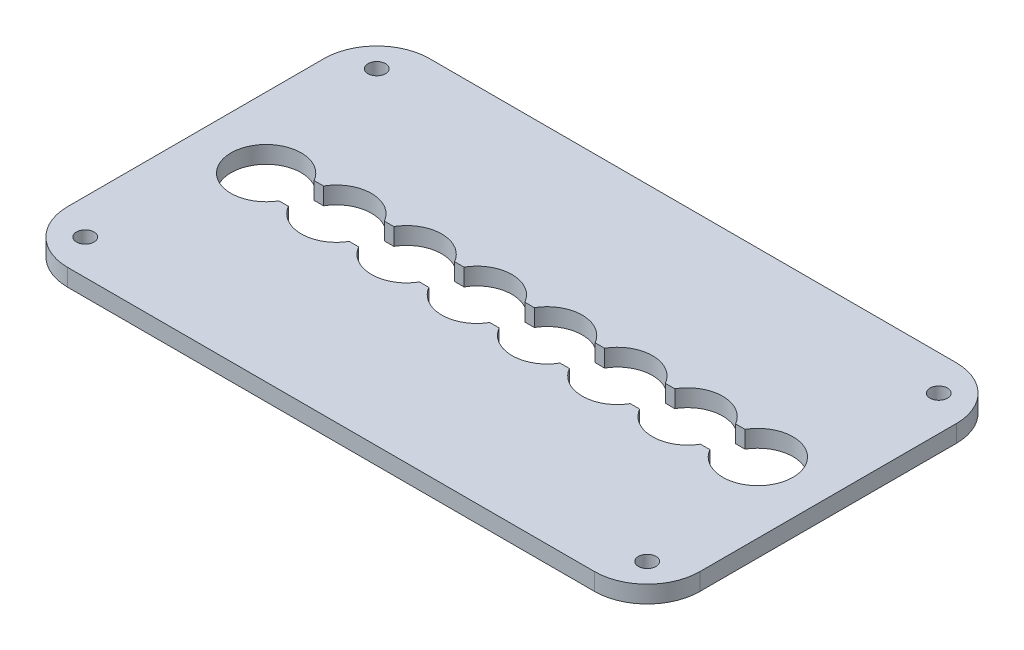
from build123d import *
from build123d.topology import SkipClean

# Parameters (mm, degrees)
SALIENTE_EXTRUIR1_DEPTH     = 103
CROQUIS2_W                  = 5
CROQUIS2_H                  = 50
CROQUIS2_H_2                = 80
SALIENTE_EXTRUIR2_DEPTH     = 35
REDONDEO1_R                 = 5
REDONDEO2_R                 = 5
SALIENTE_EXTRUIR3_DEPTH     = 322
REDONDEO4_R                 = 10
REDONDEO5_R                 = 10
CORTAR_EXTRUIR1_DEPTH       = 384.597445247
CORTAR_EXTRUIR1_DEPTH_BACK  = 384.597445247
CROQUIS4_W                  = 120
CROQUIS4_H                  = 165.437368142
CROQUIS8_W                  = 103
CROQUIS8_H                  = 7
SALIENTE_EXTRUIR5_DEPTH     = 200
REDONDEO6_R                 = 15
CROQUIS10_R                 = 2.5
CORTAR_EXTRUIR5_DEPTH       = 289.46836915
CORTAR_EXTRUIR6_DEPTH       = 10
SALIENTE_EXTRUIR6_DEPTH     = 12
CROQUIS12_W                 = 103
CROQUIS12_H                 = 5
SALIENTE_EXTRUIR7_DEPTH     = 41
REDONDEO7_R                 = 10
CORTAR_EXTRUIR7_DEPTH       = 384.597445247
CORTAR_EXTRUIR7_DEPTH_BACK  = 384.597445247
CROQUIS13_W                 = 211.982826688
CROQUIS13_H                 = 7
REDONDEO8_R                 = 5
CORTAR_EXTRUIR9_DEPTH       = 386.127251697
CORTAR_EXTRUIR9_DEPTH_BACK  = 386.127251697
CROQUIS14_W                 = 102.672801221
CROQUIS14_H                 = 112.094986942
REDONDEO9_R                 = 15
CORTAR_EXTRUIR10_DEPTH      = 295.63536787
CORTAR_EXTRUIR10_DEPTH_BACK = 295.63536787
CROQUIS15_R                 = 2.5
CORTAR_EXTRUIR11_DEPTH      = 0.1


# Some blends are built 0.0001 mm under size
with BuildPart() as part:
    # Croquis1 → Saliente-Extruir1 (new body)
    with BuildSketch(Plane.XY):
        with BuildLine():
            Line((0, 0), (0, -5))
            ThreePointArc((0, -5), (4.393398282, -15.606601718), (15, -20))
            Line((15, -20), (337, -20))
            ThreePointArc((337, -20), (347.606601718, -15.606601718), (352, -5))
            Line((352, -5), (352, 0))
            Line((352, 0), (367, 0))
            Line((367, 0), (367, -5))
            ThreePointArc((367, -5), (358.213203436, -26.213203436), (337, -35))
            Line((337, -35), (15, -35))
            ThreePointArc((15, -35), (-6.213203436, -26.213203436), (-15, -5))
            Line((-15, -5), (-15, 0))
            Line((-15, 0), (0, 0))
        make_face()
    extrude(amount=SALIENTE_EXTRUIR1_DEPTH)

    # Croquis2 → Saliente-Extruir2 (add)
    with BuildSketch(Plane(origin=(0, 0, 0), x_dir=(1, 0, 0), z_dir=(0, 1, 0))):
        with Locations((-7.5, -50.145888002)):
            Rectangle(CROQUIS2_W, CROQUIS2_H)
        with Locations((359.5, -51.5)):
            Rectangle(CROQUIS2_W, CROQUIS2_H_2)
    extrude(amount=SALIENTE_EXTRUIR2_DEPTH)

    # Redondeo1
    redondeo1_edges = [part.edges().sort_by_distance(p)[0] for p in [
        (-10, 0, 50.145888002),
        (-7.5, 0, 75.145888002),
        (-5, 0, 50.145888002),
        (-7.5, 0, 25.145888002),
        (357, 0, 51.5),
        (359.5, 0, 91.5),
        (362, 0, 51.5),
        (359.5, 0, 11.5),
    ]]
    fillet(redondeo1_edges, radius=REDONDEO1_R - 0.0001)  # a hair under: the kernel refuses the full size

    # Redondeo2
    redondeo2_edges = [part.edges().sort_by_distance(p)[0] for p in [
        (-7.5, 35, 75.145888002),
        (-7.5, 35, 25.145888002),
        (359.5, 35, 91.5),
        (359.5, 35, 11.5),
    ]]
    fillet(redondeo2_edges, radius=REDONDEO2_R)

    # Croquis3 → Saliente-Extruir3 (add)
    with BuildSketch(Plane(origin=(15, 0, 0), x_dir=(0, 0, -1), z_dir=(1, 0, 0))):
        Polygon((-76.5, -35), (-70.5, -35), (-70.5, -37), (-32.5, -37), (-32.5, -35), (-26.5, -35), (-26.5, -43), (-76.5, -43), align=None)
    extrude(amount=SALIENTE_EXTRUIR3_DEPTH)

    # Redondeo4
    # the kernel refuses this fillet: 10 mm, written as the material it adds along each edge
    with BuildSketch(Plane(origin=(15, -35, 76.5), x_dir=(0, 0, 1), z_dir=(1, 0, 0))) as redondeo4_piece_1:
        with BuildLine():
            CenterArc((9.797958971, 10), REDONDEO4_R, 191.536959033, 78.463040967)
            Line((0, 8), (-0.195959179, 7.96))
            ThreePointArc((-0.195959179, 7.96), (-0.2, 4), (-0.2, 0))
            Line((-0.2, 0), (0, -0.2))
            Line((0, -0.2), (9.797958971, -0.2))
            Line((9.797958971, -0.2), (9.797958971, 0))
        make_face()
    extrude(amount=322)
    with BuildSketch(Plane(origin=(15, -35, 26.5), x_dir=(0, 0, -1), z_dir=(1, 0, 0))) as redondeo4_piece_2:
        with BuildLine():
            CenterArc((9.797958971, -10), REDONDEO4_R, 90, 78.463040967)
            Line((0, -8), (-0.195959179, -7.96))
            ThreePointArc((-0.195959179, -7.96), (-0.2, -4), (-0.2, 0))
            Line((-0.2, 0), (0, 0.2))
            Line((0, 0.2), (9.797958971, 0.2))
            Line((9.797958971, 0.2), (9.797958971, 0))
        make_face()
    extrude(amount=322)

    # Redondeo5
    redondeo5_edges = [part.edges().sort_by_distance(p)[0] for p in [
        (176, -43, 76.5),
        (176, -43, 26.5),
    ]]
    fillet(redondeo5_edges, radius=REDONDEO5_R)

    # Croquis4 → Cortar-Extruir1 (cut, two sides: drawn at the far end of the back side and taken through both)
    with BuildSketch(Plane.XY.offset(103).offset(-CORTAR_EXTRUIR1_DEPTH_BACK)):
        with Locations((236, 7.126913707)):
            Rectangle(CROQUIS4_W, CROQUIS4_H)
    extrude(amount=CORTAR_EXTRUIR1_DEPTH + CORTAR_EXTRUIR1_DEPTH_BACK, mode=Mode.SUBTRACT)


with BuildPart() as body_2:
    # of the pieces the cut leaves, the one that is kept (cortar_extruir1_keep)
    add(part.part.solids().sort_by_distance((296, -39, 24.702041029))[0])

    # Croquis8 → Saliente-Extruir5 (add)
    with BuildSketch(Plane.ZY.offset(-296)):
        with Locations((51.5, -23.5)):
            Rectangle(CROQUIS8_W, CROQUIS8_H)
    extrude(amount=SALIENTE_EXTRUIR5_DEPTH)

    # Redondeo6
    redondeo6_edges = [body_2.edges().sort_by_distance(p)[0] for p in [
        (96, -23.5, 103),
        (96, -23.5, 0),
    ]]
    fillet(redondeo6_edges, radius=REDONDEO6_R)

    # Croquis10 → Cortar-Extruir5 (cut, through all)
    with BuildSketch(Plane(origin=(362, 0, 0), x_dir=(0, 0, -1), z_dir=(1, 0, 0))):
        with Locations(Location((-80.5, 20, 0), (0, 0, 90))):
            Circle(CROQUIS10_R)
        with Locations(Location((-22.5, 20, 0), (0, 0, 90))):
            Circle(CROQUIS10_R)
    extrude(amount=-CORTAR_EXTRUIR5_DEPTH, mode=Mode.SUBTRACT)

    # Croquis9 → Cortar-Extruir6 (cut)
    with BuildSketch(Plane.XZ.offset(27)):
        with BuildLine():
            Line((144.660254038, 56.5), (147.339745962, 56.5))
            ThreePointArc((147.339745962, 56.5), (156, 61.5), (164.660254038, 56.5))
            Line((164.660254038, 56.5), (167.339745962, 56.5))
            ThreePointArc((167.339745962, 56.5), (176, 61.5), (184.660254038, 56.5))
            Line((184.660254038, 56.5), (187.339745962, 56.5))
            ThreePointArc((187.339745962, 56.5), (196, 61.5), (204.660254038, 56.5))
            Line((204.660254038, 56.5), (207.339745962, 56.5))
            ThreePointArc((207.339745962, 56.5), (216, 61.5), (224.660254038, 56.5))
            Line((224.660254038, 56.5), (227.339745962, 56.5))
            ThreePointArc((227.339745962, 56.5), (236, 61.5), (244.660254038, 56.5))
            Line((244.660254038, 56.5), (247.339745962, 56.5))
            ThreePointArc((247.339745962, 56.5), (266, 51.5), (247.339745962, 46.5))
            Line((247.339745962, 46.5), (244.660254038, 46.5))
            ThreePointArc((244.660254038, 46.5), (236, 41.5), (227.339745962, 46.5))
            Line((227.339745962, 46.5), (224.660254038, 46.5))
            ThreePointArc((224.660254038, 46.5), (216, 41.5), (207.339745962, 46.5))
            Line((207.339745962, 46.5), (204.660254038, 46.5))
            ThreePointArc((204.660254038, 46.5), (196, 41.5), (187.339745962, 46.5))
            Line((187.339745962, 46.5), (184.660254038, 46.5))
            ThreePointArc((184.660254038, 46.5), (176, 41.5), (167.339745962, 46.5))
            Line((167.339745962, 46.5), (164.660254038, 46.5))
            ThreePointArc((164.660254038, 46.5), (156, 41.5), (147.339745962, 46.5))
            Line((147.339745962, 46.5), (144.660254038, 46.5))
            ThreePointArc((144.660254038, 46.5), (136, 41.5), (127.339745962, 46.5))
            Line((127.339745962, 46.5), (124.660254038, 46.5))
            ThreePointArc((124.660254038, 46.5), (106, 51.5), (124.660254038, 56.5))
            Line((124.660254038, 56.5), (127.339745962, 56.5))
            ThreePointArc((127.339745962, 56.5), (136, 61.5), (144.660254038, 56.5))
        make_face()
    extrude(amount=-CORTAR_EXTRUIR6_DEPTH, mode=Mode.SUBTRACT)

    # Croquis11 → Saliente-Extruir6 (add)
    with BuildSketch(Plane.XZ.offset(27)):
        with BuildLine():
            Line((96, 88), (96, 15))
            ThreePointArc((96, 15), (100.393398282, 4.393398282), (111, 0))
            Line((111, 0), (296, 0))
            Line((296, 0), (296, 103))
            Line((296, 103), (111, 103))
            ThreePointArc((111, 103), (100.393398282, 98.606601718), (96, 88))
        make_face()
        with BuildLine():
            Line((247.339745962, 56.5), (244.660254038, 56.5))
            ThreePointArc((244.660254038, 56.5), (236, 61.5), (227.339745962, 56.5))
            Line((227.339745962, 56.5), (224.660254038, 56.5))
            ThreePointArc((224.660254038, 56.5), (216, 61.5), (207.339745962, 56.5))
            Line((207.339745962, 56.5), (204.660254038, 56.5))
            ThreePointArc((204.660254038, 56.5), (196, 61.5), (187.339745962, 56.5))
            Line((187.339745962, 56.5), (184.660254038, 56.5))
            ThreePointArc((184.660254038, 56.5), (176, 61.5), (167.339745962, 56.5))
            Line((167.339745962, 56.5), (164.660254038, 56.5))
            ThreePointArc((164.660254038, 56.5), (156, 61.5), (147.339745962, 56.5))
            Line((147.339745962, 56.5), (144.660254038, 56.5))
            ThreePointArc((144.660254038, 56.5), (136, 61.5), (127.339745962, 56.5))
            Line((127.339745962, 56.5), (124.660254038, 56.5))
            ThreePointArc((124.660254038, 56.5), (106, 51.5), (124.660254038, 46.5))
            Line((124.660254038, 46.5), (127.339745962, 46.5))
            ThreePointArc((127.339745962, 46.5), (136, 41.5), (144.660254038, 46.5))
            Line((144.660254038, 46.5), (147.339745962, 46.5))
            ThreePointArc((147.339745962, 46.5), (156, 41.5), (164.660254038, 46.5))
            Line((164.660254038, 46.5), (167.339745962, 46.5))
            ThreePointArc((167.339745962, 46.5), (176, 41.5), (184.660254038, 46.5))
            Line((184.660254038, 46.5), (187.339745962, 46.5))
            ThreePointArc((187.339745962, 46.5), (196, 41.5), (204.660254038, 46.5))
            Line((204.660254038, 46.5), (207.339745962, 46.5))
            ThreePointArc((207.339745962, 46.5), (216, 41.5), (224.660254038, 46.5))
            Line((224.660254038, 46.5), (227.339745962, 46.5))
            ThreePointArc((227.339745962, 46.5), (236, 41.5), (244.660254038, 46.5))
            Line((244.660254038, 46.5), (247.339745962, 46.5))
            ThreePointArc((247.339745962, 46.5), (266, 51.5), (247.339745962, 56.5))
        make_face(mode=Mode.SUBTRACT)
    extrude(amount=-SALIENTE_EXTRUIR6_DEPTH)

    # Croquis12 → Saliente-Extruir7 (add)
    with SkipClean():  # the faces are left unmerged after this step: merging them gives an invalid solid
        with BuildSketch(Plane(origin=(296, 0, 0), x_dir=(0, 0, -1), z_dir=(1, 0, 0))):
            with Locations((-51.5, -17.5)):
                Rectangle(CROQUIS12_W, CROQUIS12_H)
        extrude(amount=SALIENTE_EXTRUIR7_DEPTH)
    add(body_2.part.scale(1), mode=Mode.REPLACE)  # the faces are merged on a copy

    # Redondeo7
    # the kernel refuses this fillet: 10 mm, written as the material it takes off along each edge
    with BuildSketch(Plane(origin=(337, -15, -21.650635095), x_dir=(0, -1, 0), z_dir=(0, 0, 1))) as redondeo7_piece_1:
        with BuildLine():
            CenterArc((10, -8.660254038), REDONDEO7_R, 120, 60)
            Line((0, -8.660254038), (-0.2, -8.660254038))
            Line((-0.2, -8.660254038), (-0.2, 0))
            Line((-0.2, 0), (0, 0.2))
            ThreePointArc((0, 0.2), (2.5, 0.2), (4.9, 0.173205081))
            Line((4.9, 0.173205081), (5, 0))
        make_face()
    extrude(amount=146.301270189, mode=Mode.SUBTRACT)

    # Croquis13 → Cortar-Extruir7 (cut, two sides: drawn at the far end of the back side and taken through both)
    with BuildSketch(Plane.XY.offset(103).offset(-CORTAR_EXTRUIR7_DEPTH_BACK)):
        with Locations((190.008586656, -23.5)):
            Rectangle(CROQUIS13_W, CROQUIS13_H)
    extrude(amount=CORTAR_EXTRUIR7_DEPTH + CORTAR_EXTRUIR7_DEPTH_BACK, mode=Mode.SUBTRACT)

    # Redondeo8
    redondeo8_edges = [body_2.edges().sort_by_distance(p)[0] for p in [
        (296, -20, 51.5),
    ]]
    fillet(redondeo8_edges, radius=REDONDEO8_R)

    # Croquis14 → Cortar-Extruir9 (cut, two sides: drawn at the far end of the back side and taken through both)
    with BuildSketch(Plane.XZ.offset(20).offset(-CORTAR_EXTRUIR9_DEPTH_BACK)):
        with Locations((327.336400611, 46.952506529)):
            Rectangle(CROQUIS14_W, CROQUIS14_H)
    extrude(amount=CORTAR_EXTRUIR9_DEPTH + CORTAR_EXTRUIR9_DEPTH_BACK, mode=Mode.SUBTRACT)

    # Redondeo9
    redondeo9_edges = [body_2.edges().sort_by_distance(p)[0] for p in [
        (276, -17.5, 0),
        (276, -17.5, 103),
    ]]
    fillet(redondeo9_edges, radius=REDONDEO9_R)

    # Croquis15 → Cortar-Extruir10 (cut, two sides: drawn at the far end of the back side and taken through both)
    with BuildSketch(Plane.XZ.offset(20).offset(-CORTAR_EXTRUIR10_DEPTH_BACK)):
        with Locations(Location((106, 93, 0), (0, 0, 270))):
            Circle(CROQUIS15_R)
        with Locations(Location((106, 10, 0), (0, 0, 270))):
            Circle(CROQUIS15_R)
        with Locations(Location((266, 10, 0), (0, 0, 90))):
            Circle(CROQUIS15_R)
        with Locations(Location((266, 93, 0), (0, 0, 90))):
            Circle(CROQUIS15_R)
    extrude(amount=CORTAR_EXTRUIR10_DEPTH + CORTAR_EXTRUIR10_DEPTH_BACK, mode=Mode.SUBTRACT)

    # Croquis16 → Cortar-Extruir11 (cut)
    with BuildSketch(Plane.XZ.offset(20)):
        with BuildLine():
            Line((111, 0), (261, 0))
            ThreePointArc((261, 0), (271.606601718, 4.393398282), (276, 15))
            Line((276, 15), (276, 88))
            ThreePointArc((276, 88), (271.606601718, 98.606601718), (261, 103))
            Line((261, 103), (111, 103))
            ThreePointArc((111, 103), (100.393398282, 98.606601718), (96, 88))
            Line((96, 88), (96, 15))
            ThreePointArc((96, 15), (100.393398282, 4.393398282), (111, 0))
        make_face()
    extrude(amount=-CORTAR_EXTRUIR11_DEPTH, mode=Mode.SUBTRACT)


solid = body_2.part
